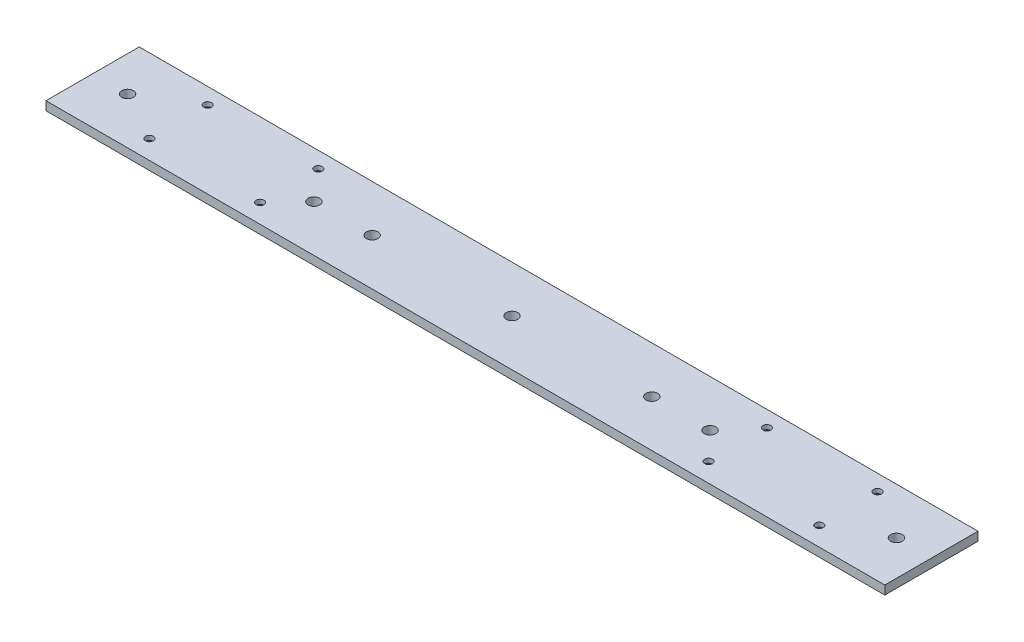
from build123d import *

# Parameters (mm, degrees)
SKETCH1_W                                     = 457.2
SKETCH1_H                                     = 50.8
BOSS_EXTRUDE1_DEPTH                           = 4.7625
SKETCH2_R                                     = 3.175
CUT_EXTRUDE1_DEPTH                            = 244.602
SKETCH3_R                                     = 3.175
CUT_EXTRUDE2_DEPTH                            = 244.602
SKETCH4_R                                     = 3.175
CUT_EXTRUDE3_DEPTH                            = 25.4
CSK_FOR_8_FLAT_HEAD_MACHINE_SCREW1_AT_2_COUNT = 2
CSK_FOR_8_FLAT_HEAD_MACHINE_SCREW1_AT_2_PITCH = 31.75
CSK_FOR_8_FLAT_HEAD_MACHINE_SCREW1_AT_3_COUNT = 2
CSK_FOR_8_FLAT_HEAD_MACHINE_SCREW1_AT_3_PITCH = 68.170141008
CSK_FOR_8_FLAT_HEAD_MACHINE_SCREW1_AT_4_COUNT = 2
CSK_FOR_8_FLAT_HEAD_MACHINE_SCREW1_AT_4_PITCH = 60.325
CSK_FOR_8_FLAT_HEAD_MACHINE_SCREW1_AT_5_COUNT = 2
CSK_FOR_8_FLAT_HEAD_MACHINE_SCREW1_AT_5_PITCH = 304.8
CSK_FOR_8_FLAT_HEAD_MACHINE_SCREW1_AT_6_COUNT = 2
CSK_FOR_8_FLAT_HEAD_MACHINE_SCREW1_AT_6_PITCH = 306.449184205
CSK_FOR_8_FLAT_HEAD_MACHINE_SCREW1_AT_7_COUNT = 2
CSK_FOR_8_FLAT_HEAD_MACHINE_SCREW1_AT_7_PITCH = 366.502835085
CSK_FOR_8_FLAT_HEAD_MACHINE_SCREW1_AT_8_COUNT = 2
CSK_FOR_8_FLAT_HEAD_MACHINE_SCREW1_AT_8_PITCH = 365.125


with BuildPart() as part:
    # Sketch1 → Boss-Extrude1 (new body)
    with BuildSketch(Plane(origin=(0, 0, 0), x_dir=(1, 0, 0), z_dir=(0, 1, 0))):
        with Locations((228.6, 25.4)):
            Rectangle(SKETCH1_W, SKETCH1_H)
    extrude(amount=BOSS_EXTRUDE1_DEPTH)

    # Sketch2 → Cut-Extrude1 (cut)
    with BuildSketch(Plane(origin=(0, 4.7625, 0), x_dir=(1, 0, 0), z_dir=(0, 1, 0))):
        with Locations((19.05, 25.4)):
            Circle(SKETCH2_R)
        with Locations((438.15, 25.4)):
            Circle(SKETCH2_R)
    extrude(amount=-CUT_EXTRUDE1_DEPTH, mode=Mode.SUBTRACT)

    # Sketch3 → Cut-Extrude2 (cut)
    with BuildSketch(Plane(origin=(0, 4.7625, 0), x_dir=(1, 0, 0), z_dir=(0, 1, 0))):
        with Locations((152.4, 25.4)):
            Circle(SKETCH3_R)
        with Locations((304.8, 25.4)):
            Circle(SKETCH3_R)
        with Locations((228.6, 25.4)):
            Circle(SKETCH3_R)
    extrude(amount=-CUT_EXTRUDE2_DEPTH, mode=Mode.SUBTRACT)

    # Sketch4 → Cut-Extrude3 (cut)
    with BuildSketch(Plane(origin=(0, 4.7625, 0), x_dir=(1, 0, 0), z_dir=(0, 1, 0))):
        with Locations((120.65, 25.4)):
            Circle(SKETCH4_R)
        with Locations((336.55, 25.4)):
            Circle(SKETCH4_R)
    extrude(amount=-CUT_EXTRUDE3_DEPTH, mode=Mode.SUBTRACT)

    # Sketch5 → CSK for #8 Flat Head Machine Screw1 (revolve, cut)
    with BuildSketch(Plane(origin=(46.0375, 0, -42.06875), x_dir=(0, 0, -1), z_dir=(1, 0, 0))):
        Polygon((0, 0), (0, 4.7625), (2.15265, 4.7625), (2.15265, 2.3740728), (4.2164, 0), align=None)
    csk_for_8_flat_head_machine_screw1 = revolve(axis=Axis((46.0375, -6.35, -42.06875), (0, 1, 0)), mode=Mode.SUBTRACT)

    # CSK for #8 Flat Head Machine Screw1 at 2: CSK for #8 Flat Head Machine Screw1 ×2
    with Locations(*[(0, 0, i * CSK_FOR_8_FLAT_HEAD_MACHINE_SCREW1_AT_2_PITCH) for i in range(1, CSK_FOR_8_FLAT_HEAD_MACHINE_SCREW1_AT_2_COUNT)]):
        add(csk_for_8_flat_head_machine_screw1, mode=Mode.SUBTRACT)

    # CSK for #8 Flat Head Machine Screw1 at 3: CSK for #8 Flat Head Machine Screw1 ×2
    with Locations(*[Vector(0.8849182223819825, 0, 0.4657464328326221) * (i * CSK_FOR_8_FLAT_HEAD_MACHINE_SCREW1_AT_3_PITCH) for i in range(1, CSK_FOR_8_FLAT_HEAD_MACHINE_SCREW1_AT_3_COUNT)]):
        add(csk_for_8_flat_head_machine_screw1, mode=Mode.SUBTRACT)

    # CSK for #8 Flat Head Machine Screw1 at 4: CSK for #8 Flat Head Machine Screw1 ×2
    with Locations(*[(i * CSK_FOR_8_FLAT_HEAD_MACHINE_SCREW1_AT_4_PITCH, 0, 0) for i in range(1, CSK_FOR_8_FLAT_HEAD_MACHINE_SCREW1_AT_4_COUNT)]):
        add(csk_for_8_flat_head_machine_screw1, mode=Mode.SUBTRACT)

    # CSK for #8 Flat Head Machine Screw1 at 5: CSK for #8 Flat Head Machine Screw1 ×2
    with Locations(*[(i * CSK_FOR_8_FLAT_HEAD_MACHINE_SCREW1_AT_5_PITCH, 0, 0) for i in range(1, CSK_FOR_8_FLAT_HEAD_MACHINE_SCREW1_AT_5_COUNT)]):
        add(csk_for_8_flat_head_machine_screw1, mode=Mode.SUBTRACT)

    # CSK for #8 Flat Head Machine Screw1 at 6: CSK for #8 Flat Head Machine Screw1 ×2
    with Locations(*[Vector(0.9946184088907778, 0, 0.103606084259456) * (i * CSK_FOR_8_FLAT_HEAD_MACHINE_SCREW1_AT_6_PITCH) for i in range(1, CSK_FOR_8_FLAT_HEAD_MACHINE_SCREW1_AT_6_COUNT)]):
        add(csk_for_8_flat_head_machine_screw1, mode=Mode.SUBTRACT)

    # CSK for #8 Flat Head Machine Screw1 at 7: CSK for #8 Flat Head Machine Screw1 ×2
    with Locations(*[Vector(0.996240588195683, 0, 0.086629616364842) * (i * CSK_FOR_8_FLAT_HEAD_MACHINE_SCREW1_AT_7_PITCH) for i in range(1, CSK_FOR_8_FLAT_HEAD_MACHINE_SCREW1_AT_7_COUNT)]):
        add(csk_for_8_flat_head_machine_screw1, mode=Mode.SUBTRACT)

    # CSK for #8 Flat Head Machine Screw1 at 8: CSK for #8 Flat Head Machine Screw1 ×2
    with Locations(*[(i * CSK_FOR_8_FLAT_HEAD_MACHINE_SCREW1_AT_8_PITCH, 0, 0) for i in range(1, CSK_FOR_8_FLAT_HEAD_MACHINE_SCREW1_AT_8_COUNT)]):
        add(csk_for_8_flat_head_machine_screw1, mode=Mode.SUBTRACT)


solid = part.part
